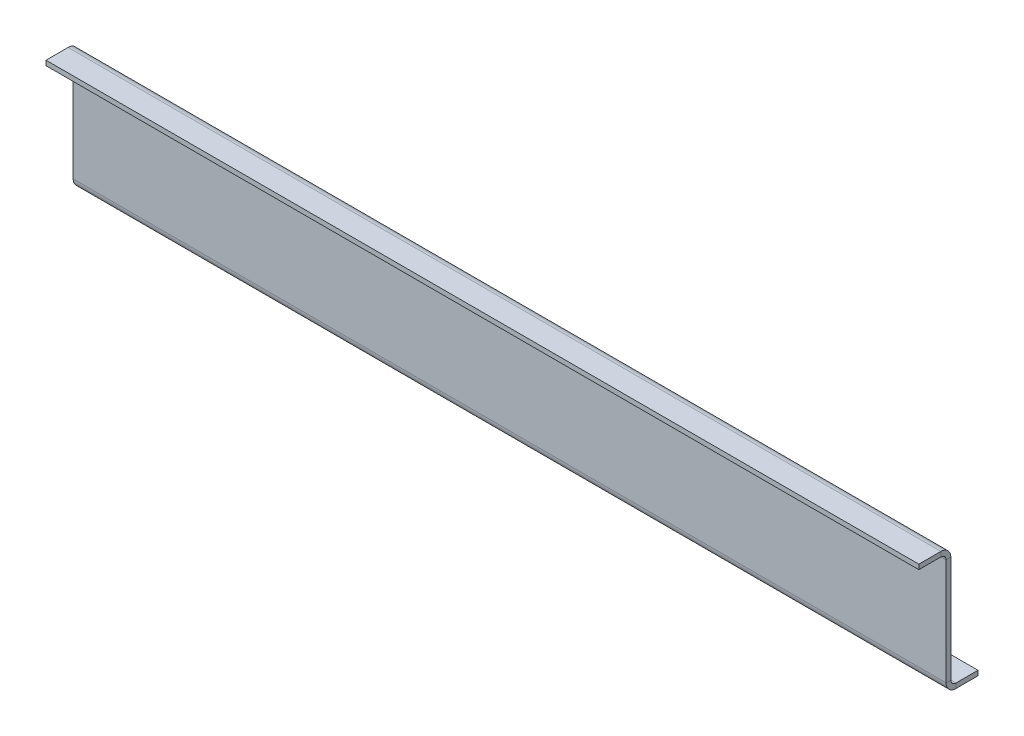
from build123d import *

# Parameters (mm, degrees)
SKETCH1_W                    = 273
SKETCH1_H                    = 39.5
BASE_FLANGE1_DEPTH           = 1.5
EDGE_FLANGE1_STRIP_W         = 9.2
EDGE_FLANGE1_STRIP_H         = 1.5
EDGE_FLANGE1_STRIP_CUT_DEPTH = 273
EDGE_FLANGE1_DEPTH           = 273
EDGE_FLANGE2_STRIP_W         = 9.2
EDGE_FLANGE2_STRIP_H         = 1.5
EDGE_FLANGE2_STRIP_CUT_DEPTH = 273
EDGE_FLANGE2_DEPTH           = 273


# Sheet-metal steps are written as plain solids
with BuildPart() as part:
    # Sketch1 → Base-Flange1 (new body)
    with BuildSketch(Plane.XY):
        Rectangle(SKETCH1_W, SKETCH1_H)
    extrude(amount=-BASE_FLANGE1_DEPTH)

    # Edge-Flange1 strip (across the edge) → Edge-Flange1 strip cut (cut)
    with BuildSketch(Plane(origin=(136.5, 19.75, 0), x_dir=(0, -1, 0), z_dir=(-1, 0, 0))):
        with Locations((-1.5, -0.75)):
            Rectangle(EDGE_FLANGE1_STRIP_W, EDGE_FLANGE1_STRIP_H)
    extrude(amount=EDGE_FLANGE1_STRIP_CUT_DEPTH, mode=Mode.SUBTRACT)

    # Edge-Flange1 section (across the edge) → Edge-Flange1 (add)
    with BuildSketch(Plane(origin=(136.5, 19.75, 0), x_dir=(0, -1, 0), z_dir=(-1, 0, 0))):
        with BuildLine():
            Line((0, 1.6), (0, 8.5))
            Line((0, 8.5), (1.5, 8.5))
            Line((1.5, 8.5), (1.5, 1.6))
            ThreePointArc((1.5, 1.6), (1.96862915, 0.46862915), (3.1, 0))
            Line((3.1, 0), (3.1, -1.5))
            ThreePointArc((3.1, -1.5), (0.907968978, -0.592031022), (0, 1.6))
        make_face()
    extrude(amount=EDGE_FLANGE1_DEPTH)

    # Edge-Flange2 strip (across the edge) → Edge-Flange2 strip cut (cut)
    with BuildSketch(Plane(origin=(136.5, -19.75, -1.5), x_dir=(0, 1, 0), z_dir=(-1, 0, 0))):
        with Locations((-1.5, -0.75)):
            Rectangle(EDGE_FLANGE2_STRIP_W, EDGE_FLANGE2_STRIP_H)
    extrude(amount=EDGE_FLANGE2_STRIP_CUT_DEPTH, mode=Mode.SUBTRACT)

    # Edge-Flange2 section (across the edge) → Edge-Flange2 (add)
    with BuildSketch(Plane(origin=(136.5, -19.75, -1.5), x_dir=(0, 1, 0), z_dir=(-1, 0, 0))):
        with BuildLine():
            Line((0, 1.6), (0, 8.5))
            Line((0, 8.5), (1.5, 8.5))
            Line((1.5, 8.5), (1.5, 1.6))
            ThreePointArc((1.5, 1.6), (1.96862915, 0.46862915), (3.1, 0))
            Line((3.1, 0), (3.1, -1.5))
            ThreePointArc((3.1, -1.5), (0.907968978, -0.592031022), (0, 1.6))
        make_face()
    extrude(amount=EDGE_FLANGE2_DEPTH)


solid = part.part
